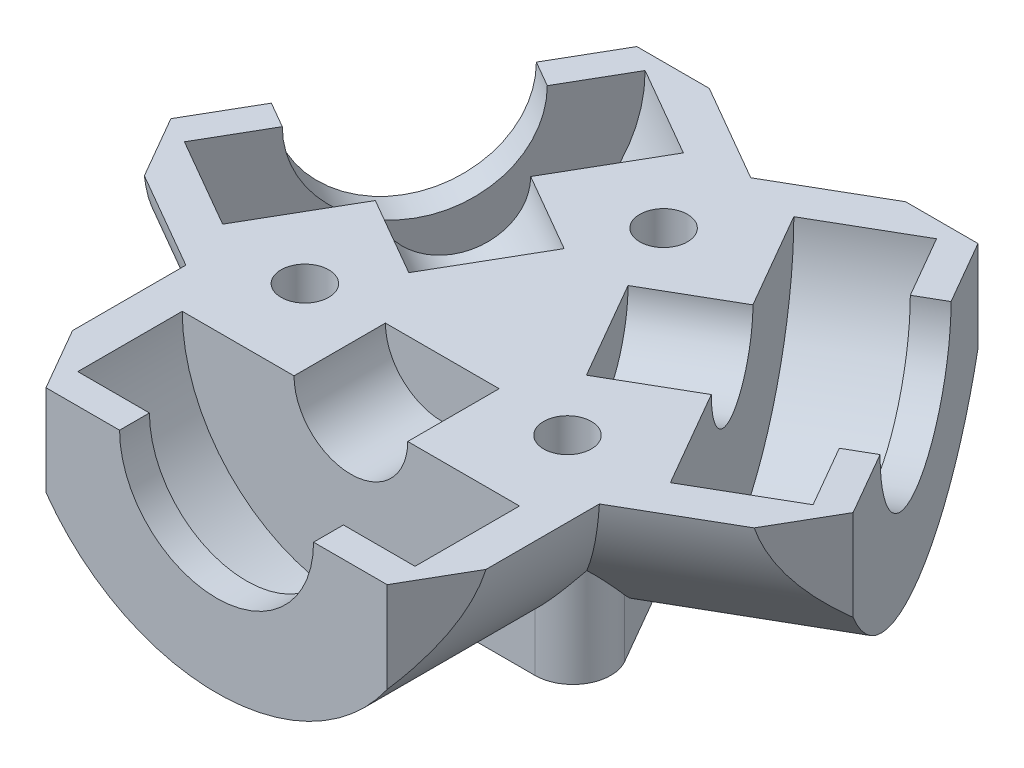
from build123d import *

# Parameters (mm, degrees)
BOSS_EXTRUDE1_DEPTH = 12.7
SKETCH7_R           = 1.6
CUT_EXTRUDE2_DEPTH  = 12.7
CIRPATTERN1_COUNT   = 3
CUT_EXTRUDE3_DEPTH  = 11.684
CIRPATTERN2_COUNT   = 3
CUT_EXTRUDE5_DEPTH  = 0.7
FILLET2_R           = 2.54


with BuildPart() as part:
    # Sketch1 → Boss-Extrude1 (new body)
    with BuildSketch(Plane(origin=(0, 0, 0), x_dir=(1, 0, 0), z_dir=(0, 1, 0))):
        Polygon((11.43, -19.797340731), (22.86, 0), (11.43, 19.797340731), (-11.43, 19.797340731), (-22.86, 0), (-11.43, -19.797340731), align=None)
    extrude(amount=BOSS_EXTRUDE1_DEPTH)

    # Sketch5 → Cut-Revolve1 (revolve, cut)
    with BuildSketch(Plane(origin=(0, 12.7, 0), x_dir=(1, 0, 0), z_dir=(0, 1, 0))):
        Polygon((0, -19.797340731), (0, -4.672340739), (-3.81, -4.672340739), (-3.81, -10.797340731), (-11.300000006, -10.797340731), (-11.300000006, -17.797340731), (-6.5, -17.797340731), (-6.5, -19.797340731), align=None)
    cut_revolve1 = revolve(axis=Axis((0, 12.7, 19.797340731), (0, 0, -1)), mode=Mode.SUBTRACT)

    # Sketch7 → Cut-Extrude2 (cut)
    with BuildSketch(Plane(origin=(0, 12.7, 0), x_dir=(1, 0, 0), z_dir=(0, 1, 0))):
        with Locations(Location((0, 10.16, 0), (0, 0, 270))):
            Circle(SKETCH7_R)
        with Locations(Location((8.798818102, -5.08, 0), (0, 0, 270))):
            Circle(SKETCH7_R)
        with Locations(Location((-8.798818102, -5.08, 0), (0, 0, 270))):
            Circle(SKETCH7_R)
    extrude(amount=-CUT_EXTRUDE2_DEPTH, mode=Mode.SUBTRACT)

    # CirPattern1: Cut-Revolve1 ×3 about axis
    cirpattern1_axis = Axis((0, 0, 0), (0, 1, 0))
    for i in range(1, CIRPATTERN1_COUNT):
        add(cut_revolve1.rotate(cirpattern1_axis, i * 360 / CIRPATTERN1_COUNT), mode=Mode.SUBTRACT)

    # Sketch8 → Cut-Extrude3 (cut)
    with BuildSketch(Plane.XY.offset(19.797340731)):
        with BuildLine():
            Line((-13.856406592, 12.7), (-18.662949192, 12.7))
            Line((-18.662949192, 12.7), (-18.662949192, 0))
            Line((-18.662949192, 0), (18.662949192, 0))
            Line((18.662949192, 0), (18.662949192, 12.7))
            Line((18.662949192, 12.7), (13.856406592, 12.7))
            ThreePointArc((13.856406592, 12.7), (0, 0.69999987), (-13.856406592, 12.7))
        make_face()
    cut_extrude3 = extrude(amount=-CUT_EXTRUDE3_DEPTH, mode=Mode.SUBTRACT)

    # CirPattern2: Cut-Extrude3 ×3 about axis
    cirpattern2_axis = Axis((0, 0, 0), (0, 1, 0))
    for i in range(1, CIRPATTERN2_COUNT):
        add(cut_extrude3.rotate(cirpattern2_axis, i * 360 / CIRPATTERN2_COUNT), mode=Mode.SUBTRACT)

    # Sketch10 → Cut-Extrude5 (cut)
    with BuildSketch(Plane.XZ):
        Polygon((14.052718364, 8.113340731), (-14.052718364, 8.113340731), (0, -16.226681461), align=None)
    extrude(amount=-CUT_EXTRUDE5_DEPTH, mode=Mode.SUBTRACT)

    # Fillet2
    # the kernel refuses this fillet: 2.54 mm, written as the material it takes off along each edge
    with BuildSketch(Plane(origin=(14.052718364, -10.298522628, 8.113340731), x_dir=(-0.4999999999999996, 0, -0.8660254037844387), z_dir=(0, 1, 0))) as fillet2_piece_1_section:
        with BuildLine():
            CenterArc((FILLET2_R * 1.73205080757, FILLET2_R), FILLET2_R, 150, 120)
            Line((FILLET2_R * 0.866025403784, FILLET2_R * 1.5), (0, 0))
            Line((0, 0), (FILLET2_R * 1.73205080757, 0))
        make_face()
    fillet2_piece_1 = extrude(amount=33.997045256, mode=Mode.PRIVATE)
    fillet2_piece_1 = fillet2_piece_1 - Plane(origin=(6.277314066, 14.7, -3.624208966), x_dir=(-0.49487165940112743, -0.14285714153061227, -0.8571428573086736), z_dir=(0.8660254037844388, 0, -0.49999999999999983)) * Cylinder(14.00000013, 86, mode=Mode.PRIVATE)
    fillet2_piece_1 = fillet2_piece_1 - Plane(origin=(0, 14.7, 7.248417919), x_dir=(0.9897433188022552, -0.14285714153061224, 0), z_dir=(0, 0, 1)) * Cylinder(14.00000013, 86, mode=Mode.PRIVATE)
    add(fillet2_piece_1, mode=Mode.SUBTRACT)
    with BuildSketch(Plane(origin=(0, -10.298522628, -16.226681461), x_dir=(-0.5000000000000003, 0, 0.8660254037844386), z_dir=(0, 1, 0))) as fillet2_piece_2_section:
        with BuildLine():
            CenterArc((FILLET2_R * 1.73205080757, FILLET2_R), FILLET2_R, 150, 120)
            Line((FILLET2_R * 0.866025403784, FILLET2_R * 1.5), (0, 0))
            Line((0, 0), (FILLET2_R * 1.73205080757, 0))
        make_face()
    fillet2_piece_2 = extrude(amount=33.997045256, mode=Mode.PRIVATE)
    fillet2_piece_2 = fillet2_piece_2 - Plane(origin=(6.277314055, 14.7, -3.62420896), x_dir=(-0.49487165940112743, -0.14285714153061227, -0.8571428573086736), z_dir=(0.8660254037844388, 0, -0.49999999999999983)) * Cylinder(14.00000013, 86, mode=Mode.PRIVATE)
    fillet2_piece_2 = fillet2_piece_2 - Plane(origin=(-6.277314066, 14.7, -3.624208966), x_dir=(-0.4948716594011281, -0.14285714153061227, 0.8571428573086732), z_dir=(-0.8660254037844384, 0, -0.5000000000000004)) * Cylinder(14.00000013, 86, mode=Mode.PRIVATE)
    add(fillet2_piece_2, mode=Mode.SUBTRACT)
    with BuildSketch(Plane(origin=(-14.052718364, 23.698522628, 8.113340731), x_dir=(1, 0, 0), z_dir=(0, -1, 0))) as fillet2_piece_3_section:
        with BuildLine():
            CenterArc((FILLET2_R * 1.73205080757, -FILLET2_R), FILLET2_R, 90, 120)
            Line((FILLET2_R * 0.866025403784, -FILLET2_R * 1.5), (0, 0))
            Line((0, 0), (FILLET2_R * 1.73205080757, 0))
        make_face()
    fillet2_piece_3 = extrude(amount=33.997045256, mode=Mode.PRIVATE)
    fillet2_piece_3 = fillet2_piece_3 - Plane(origin=(0, 14.7, 7.248417932), x_dir=(0.9897433188022552, -0.14285714153061224, 0), z_dir=(0, 0, 1)) * Cylinder(14.00000013, 86, mode=Mode.PRIVATE)
    fillet2_piece_3 = fillet2_piece_3 - Plane(origin=(-6.277314055, 14.7, -3.62420896), x_dir=(-0.4948716594011281, -0.14285714153061227, 0.8571428573086732), z_dir=(-0.8660254037844384, 0, -0.5000000000000004)) * Cylinder(14.00000013, 86, mode=Mode.PRIVATE)
    add(fillet2_piece_3, mode=Mode.SUBTRACT)


solid = part.part
